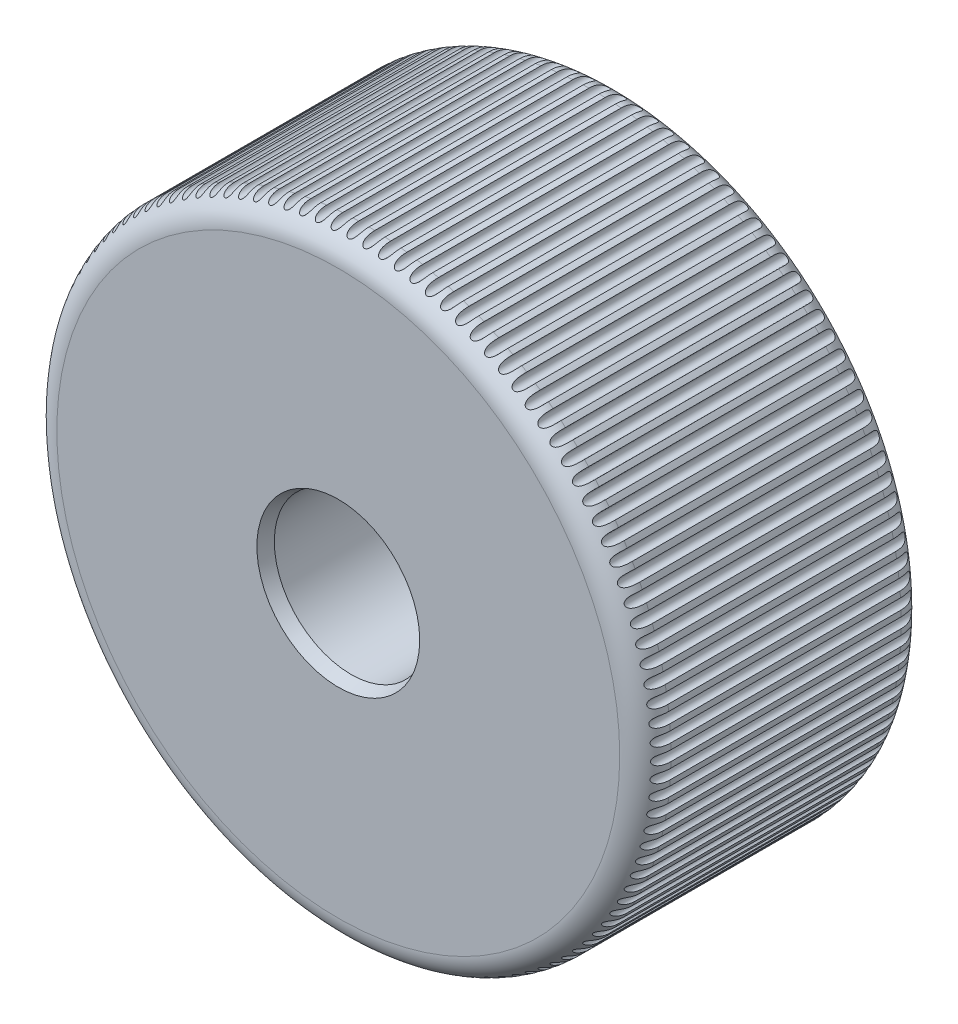
from build123d import *

# Parameters (mm, degrees)
SKETCH_1_R               = 12
SKETCH_1_R_2             = 3
EXTRUDE_1_DEPTH          = 11
EXTRUDE_2_DEPTH          = 2
EXTRUDE_3_DEPTH          = 6
CHAMFER_1_SIZE2          = 4
CHAMFER_1_SIZE           = 0.209631117
CHAMFER_2_SIZE2          = 4
CHAMFER_2_SIZE           = 0.209631117
FILLET_1_R               = 1
CHAMFER_3_SIZE           = 0.5
CHAMFER_3_SIZE2          = 0.181985117
SKETCH_2_R               = 0.2
CUT_EXTRUDE_2_DEPTH      = 21.223748416
PATTERN_CIRCULAR_1_COUNT = 120


with BuildPart() as part:
    # Эскиз1 → Бобышка-Вытянуть1 (new body)
    with BuildSketch(Plane.XY):
        Circle(SKETCH_1_R)
        Circle(SKETCH_1_R_2, mode=Mode.SUBTRACT)
    extrude(amount=EXTRUDE_1_DEPTH)

    # Эскиз1<3> → Бобышка-Вытянуть2 (add)
    with BuildSketch(Plane.XY):
        with BuildLine():
            ThreePointArc((2.939387691, 0.6), (0, 3), (-2.939387691, 0.6))
            Line((-2.939387691, 0.6), (2.939387691, 0.6))
        make_face()
        with BuildLine():
            Line((2.939387691, 0.6), (-2.939387691, 0.6))
            ThreePointArc((-2.939387691, 0.6), (-3, 0), (-2.939387691, -0.6))
            Line((-2.939387691, -0.6), (2.939387691, -0.6))
            ThreePointArc((2.939387691, -0.6), (2.984808459, -0.301526886), (3, 0))
            ThreePointArc((3, 0), (2.984808459, 0.301526886), (2.939387691, 0.6))
        make_face()
        with BuildLine():
            Line((2.939387691, -0.6), (-2.939387691, -0.6))
            ThreePointArc((-2.939387691, -0.6), (0, -3), (2.939387691, -0.6))
        make_face()
    extrude(amount=EXTRUDE_2_DEPTH)

    # Эскиз1<4> → Бобышка-Вытянуть3 (add)
    with BuildSketch(Plane.XY):
        with BuildLine():
            Line((2.939387691, 0.6), (-2.939387691, 0.6))
            ThreePointArc((-2.939387691, 0.6), (-3, 0), (-2.939387691, -0.6))
            Line((-2.939387691, -0.6), (2.939387691, -0.6))
            ThreePointArc((2.939387691, -0.6), (2.984808459, -0.301526886), (3, 0))
            ThreePointArc((3, 0), (2.984808459, 0.301526886), (2.939387691, 0.6))
        make_face()
    extrude(amount=EXTRUDE_3_DEPTH)

    # Фаска1
    chamfer_1_edges = [part.edges().sort_by_distance(p)[0] for p in [
        (0, 0.6, 6),
    ]]
    chamfer_1_side = [part.faces().sort_by_distance(p)[0] for p in [
        (0, 0.595807378, 6),
    ]]
    chamfer(chamfer_1_edges, length=CHAMFER_1_SIZE - 0.0001, length2=CHAMFER_1_SIZE2 - 0.0001, reference=chamfer_1_side[0])  # a hair under: the kernel refuses the full size

    # Фаска2
    chamfer_2_edges = [part.edges().sort_by_distance(p)[0] for p in [
        (0, -0.6, 6),
    ]]
    chamfer_2_side = [part.faces().sort_by_distance(p)[0] for p in [
        (0, -0.595807378, 6),
    ]]
    chamfer(chamfer_2_edges, length=CHAMFER_2_SIZE - 0.0001, length2=CHAMFER_2_SIZE2 - 0.0001, reference=chamfer_2_side[0])  # a hair under: the kernel refuses the full size

    # Скругление1
    fillet_1_edges = [part.edges().sort_by_distance(p)[0] for p in [
        (-12, 0, 11),
        (-12, 0, 0),
    ]]
    fillet(fillet_1_edges, radius=FILLET_1_R)

    # Фаска3
    chamfer_3_edges = [part.edges().sort_by_distance(p)[0] for p in [
        (-3, 0, 11),
    ]]
    chamfer_3_side = [part.faces().sort_by_distance(p)[0] for p in [
        (-3, 0, 6.5),
    ]]
    chamfer(chamfer_3_edges, length=CHAMFER_3_SIZE, length2=CHAMFER_3_SIZE2, reference=chamfer_3_side[0])

    # Эскиз2 → Вырез-Вытянуть2 (cut, symmetric)
    with BuildSketch(Plane.XY.offset(11)):
        with Locations((0, 12)):
            Circle(SKETCH_2_R)
    cut_extrude_2 = extrude(amount=CUT_EXTRUDE_2_DEPTH, both=True, mode=Mode.SUBTRACT)

    # Круговой массив1: Вырез-Вытянуть2 ×120 about axis
    pattern_circular_1_axis = Axis((0, 0, 0), (0, 0, 1))
    for i in range(1, PATTERN_CIRCULAR_1_COUNT):
        add(cut_extrude_2.rotate(pattern_circular_1_axis, i * 360 / PATTERN_CIRCULAR_1_COUNT), mode=Mode.SUBTRACT)


solid = part.part
